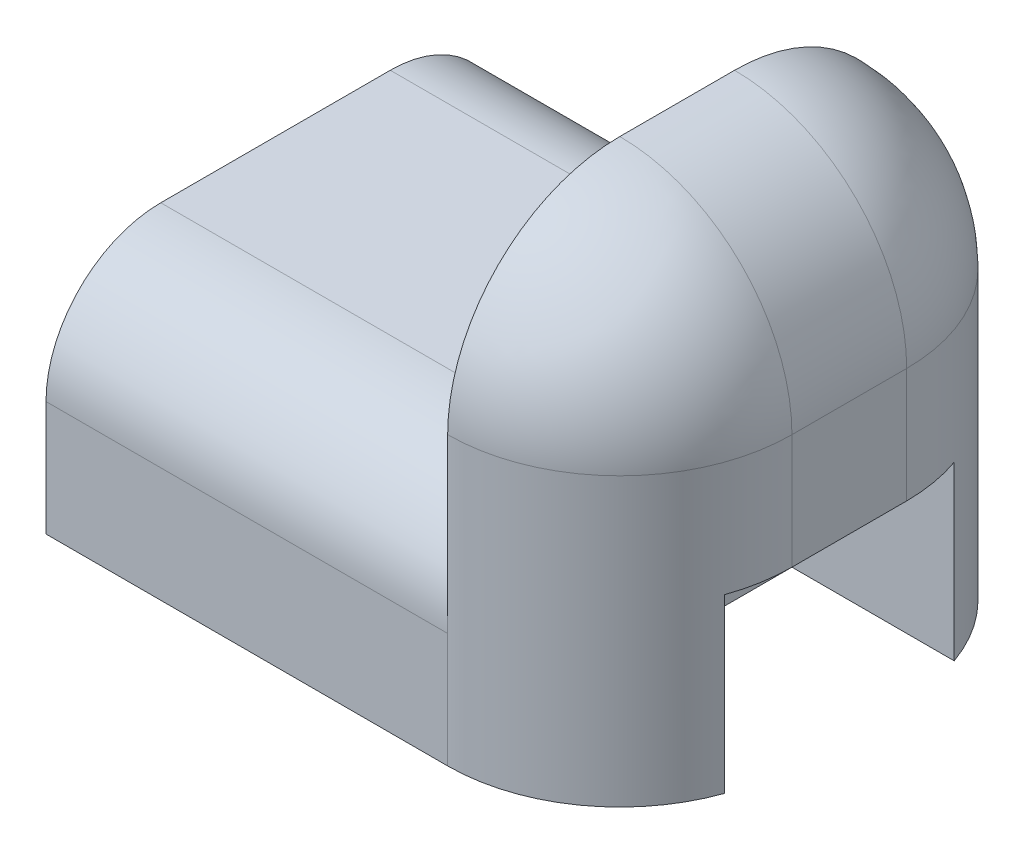
from build123d import *

# Parameters (mm, degrees)
SKETCH_1_W          = 100
SKETCH_1_H          = 40
EXTRUDE_1_DEPTH     = 80
SKETCH_3_W          = 30
SKETCH_3_H          = 30
CUT_EXTRUDE_2_DEPTH = 20
SKETCH_6_R          = 5
EXTRUDE_2_DEPTH     = 20
SKETCH_7_W          = 70
SKETCH_7_H          = 80
CUT_EXTRUDE_3_DEPTH = 40
FILLET_1_R          = 30
FILLET_2_R          = 30
FILLET_3_R          = 30
FILLET_4_R          = 20
FILLET_5_R          = 20
SKETCH1_R           = 5
CUT_EXTRUDE1_DEPTH  = 5


with BuildPart() as part:
    # 草圖1 → 填料-伸長1 (new body)
    with BuildSketch(Plane(origin=(0, 0, 0), x_dir=(1, 0, 0), z_dir=(0, 1, 0))):
        Rectangle(SKETCH_1_W, SKETCH_1_H)
    extrude_1 = extrude(amount=EXTRUDE_1_DEPTH)

    # 草圖3 → 除料-伸長2 (cut)
    with BuildSketch(Plane.XY.offset(20)):
        with Locations((-35, 15)):
            Rectangle(SKETCH_3_W, SKETCH_3_H)
        with Locations((35, 15)):
            Rectangle(SKETCH_3_W, SKETCH_3_H)
    cut_extrude_2 = extrude(amount=-CUT_EXTRUDE_2_DEPTH, mode=Mode.SUBTRACT)

    # 草圖6 → 填料-伸長2 (add)
    with BuildSketch(Plane.XY):
        with Locations((-43, 7)):
            Circle(SKETCH_6_R)
    extrude_2 = extrude(amount=EXTRUDE_2_DEPTH)

    # 鏡射3: 填料-伸長1, 除料-伸長2, 填料-伸長2 across plane
    add(extrude_1.mirror(Plane(origin=(-50, 80, 20), x_dir=(1, 0, 0), z_dir=(0, 0, -1))))
    add(cut_extrude_2.mirror(Plane(origin=(-50, 80, 20), x_dir=(1, 0, 0), z_dir=(0, 0, -1))), mode=Mode.SUBTRACT)
    add(extrude_2.mirror(Plane(origin=(-50, 80, 20), x_dir=(1, 0, 0), z_dir=(0, 0, -1))))

    # 草圖7 → 除料-伸長3 (cut)
    with BuildSketch(Plane(origin=(0, 80, 0), x_dir=(1, 0, 0), z_dir=(0, 1, 0))):
        with Locations((-15, -20)):
            Rectangle(SKETCH_7_W, SKETCH_7_H)
    extrude(amount=-CUT_EXTRUDE_3_DEPTH, mode=Mode.SUBTRACT)

    # 圓角1
    fillet_1_edges = [part.edges().sort_by_distance(p)[0] for p in [
        (50, 80, 20),
    ]]
    fillet(fillet_1_edges, radius=FILLET_1_R - 0.0001)  # a hair under: the kernel refuses the full size

    # 圓角2
    fillet_2_edges = [part.edges().sort_by_distance(p)[0] for p in [
        (50, 25.00005, 60),
        (41.213232725, 71.213232725, 60),
    ]]
    fillet(fillet_2_edges, radius=FILLET_2_R - 0.0001)  # a hair under: the kernel refuses the full size

    # 圓角3
    fillet_3_edges = [part.edges().sort_by_distance(p)[0] for p in [
        (50, 25.00005, -20),
        (41.213232725, 71.213232725, -20),
    ]]
    fillet(fillet_3_edges, radius=FILLET_3_R - 0.0001)  # a hair under: the kernel refuses the full size

    # 圓角4
    fillet_4_edges = [part.edges().sort_by_distance(p)[0] for p in [
        (-15, 40, 60),
    ]]
    fillet(fillet_4_edges, radius=FILLET_4_R)

    # 圓角5
    fillet_5_edges = [part.edges().sort_by_distance(p)[0] for p in [
        (-15, 40, -20),
    ]]
    fillet(fillet_5_edges, radius=FILLET_5_R)

    # Sketch1 → Cut-Extrude1 (cut)
    with BuildSketch(Plane.XZ.offset(-30)):
        with Locations((43, 20)):
            Circle(SKETCH1_R)
    extrude(amount=-CUT_EXTRUDE1_DEPTH, mode=Mode.SUBTRACT)


solid = part.part
